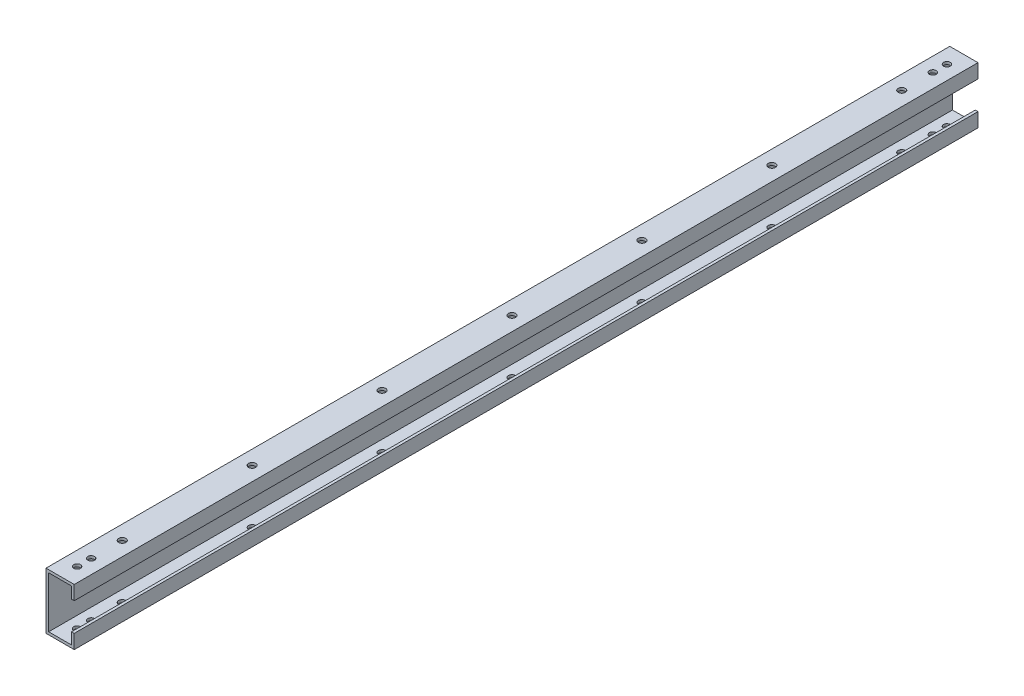
from build123d import *

# Parameters (mm, degrees)
CROQUIS1_W                         = 50
CROQUIS1_H                         = 100
CROQUIS1_W_2                       = 40.475
CROQUIS1_H_2                       = 90.475
SALIENTE_EXTRUIR1_DEPTH            = 800
CROQUIS2_W                         = 1600
CROQUIS2_H                         = 50
CORTAR_EXTRUIR1_DEPTH              = 5
CROQUIS8_R                         = 6.35
CORTAR_EXTRUIR2_DEPTH              = 130
TALADRO_DE_MARGEN_PARA_7_161_D     = 11.90498
TALADRO_DE_MARGEN_PARA_7_161_DEPTH = 151.5
TALADRO_DE_MARGEN_PARA_7_161_TIP   = 3.576616826
TALADRO_DE_MARGEN_PARA_7_162_D     = 11.90498
TALADRO_DE_MARGEN_PARA_7_162_DEPTH = 151.5
TALADRO_DE_MARGEN_PARA_7_162_TIP   = 3.576616826


with BuildPart() as part:
    # Croquis1 → Saliente-Extruir1 (new, symmetric)
    with BuildSketch(Plane.XY):
        Rectangle(CROQUIS1_W, CROQUIS1_H)
        Rectangle(CROQUIS1_W_2, CROQUIS1_H_2, mode=Mode.SUBTRACT)
    extrude(amount=SALIENTE_EXTRUIR1_DEPTH, both=True)

    # Croquis2 → Cortar-Extruir1 (cut)
    with BuildSketch(Plane(origin=(25, 0, 0), x_dir=(0, 0, -1), z_dir=(1, 0, 0))):
        Rectangle(CROQUIS2_W, CROQUIS2_H)
    extrude(amount=-CORTAR_EXTRUIR1_DEPTH, mode=Mode.SUBTRACT)

    # Croquis8 → Cortar-Extruir2 (cut)
    with BuildSketch(Plane(origin=(25, 50, 0), x_dir=(0, 0, 1), z_dir=(0, -1, 0))):
        with Locations((0, 25)):
            Circle(CROQUIS8_R)
        with Locations((230, 25)):
            Circle(CROQUIS8_R)
        with Locations((460, 25)):
            Circle(CROQUIS8_R)
        with Locations((690, 25)):
            Circle(CROQUIS8_R)
        with Locations((920, 25)):
            Circle(CROQUIS8_R)
        with Locations((1150, 25)):
            Circle(CROQUIS8_R)
        with Locations((1380, 25)):
            Circle(CROQUIS8_R)
        with Locations((1610, 25)):
            Circle(CROQUIS8_R)
        with Locations((-230, 25)):
            Circle(CROQUIS8_R)
        with Locations((-460, 25)):
            Circle(CROQUIS8_R)
        with Locations((-690, 25)):
            Circle(CROQUIS8_R)
        with Locations((-920, 25)):
            Circle(CROQUIS8_R)
        with Locations((-1150, 25)):
            Circle(CROQUIS8_R)
        with Locations((-1380, 25)):
            Circle(CROQUIS8_R)
        with Locations((-1610, 25)):
            Circle(CROQUIS8_R)
    extrude(amount=CORTAR_EXTRUIR2_DEPTH, mode=Mode.SUBTRACT)

    # Taladro de margen para 7/161
    with Locations(Plane(origin=(349.311711603, -55.2375, 12.24117116), x_dir=(-1, 0, 0), z_dir=(0, -1, 0))):
        with Locations((-600.688288397, 757.24117116), (-600.688288397, 782.24117116), (349.311711603, 782.24117116), (349.311711603, 757.24117116)):
            Hole(TALADRO_DE_MARGEN_PARA_7_161_D / 2, depth=TALADRO_DE_MARGEN_PARA_7_161_DEPTH)
            with Locations((0, 0, -(TALADRO_DE_MARGEN_PARA_7_161_DEPTH + TALADRO_DE_MARGEN_PARA_7_161_TIP / 2))):  # 118° drill point
                Cone(0, TALADRO_DE_MARGEN_PARA_7_161_D / 2, TALADRO_DE_MARGEN_PARA_7_161_TIP, mode=Mode.SUBTRACT)

    # Taladro de margen para 7/162
    with Locations(Plane(origin=(600.688288397, -55.2375, -12.24117116), x_dir=(1, 0, 0), z_dir=(0, -1, 0))):
        with Locations((-600.688288397, 757.24117116), (-600.688288397, 782.24117116), (349.311711603, 782.24117116), (349.311711603, 757.24117116)):
            Hole(TALADRO_DE_MARGEN_PARA_7_162_D / 2, depth=TALADRO_DE_MARGEN_PARA_7_162_DEPTH)
            with Locations((0, 0, -(TALADRO_DE_MARGEN_PARA_7_162_DEPTH + TALADRO_DE_MARGEN_PARA_7_162_TIP / 2))):  # 118° drill point
                Cone(0, TALADRO_DE_MARGEN_PARA_7_162_D / 2, TALADRO_DE_MARGEN_PARA_7_162_TIP, mode=Mode.SUBTRACT)


solid = part.part
